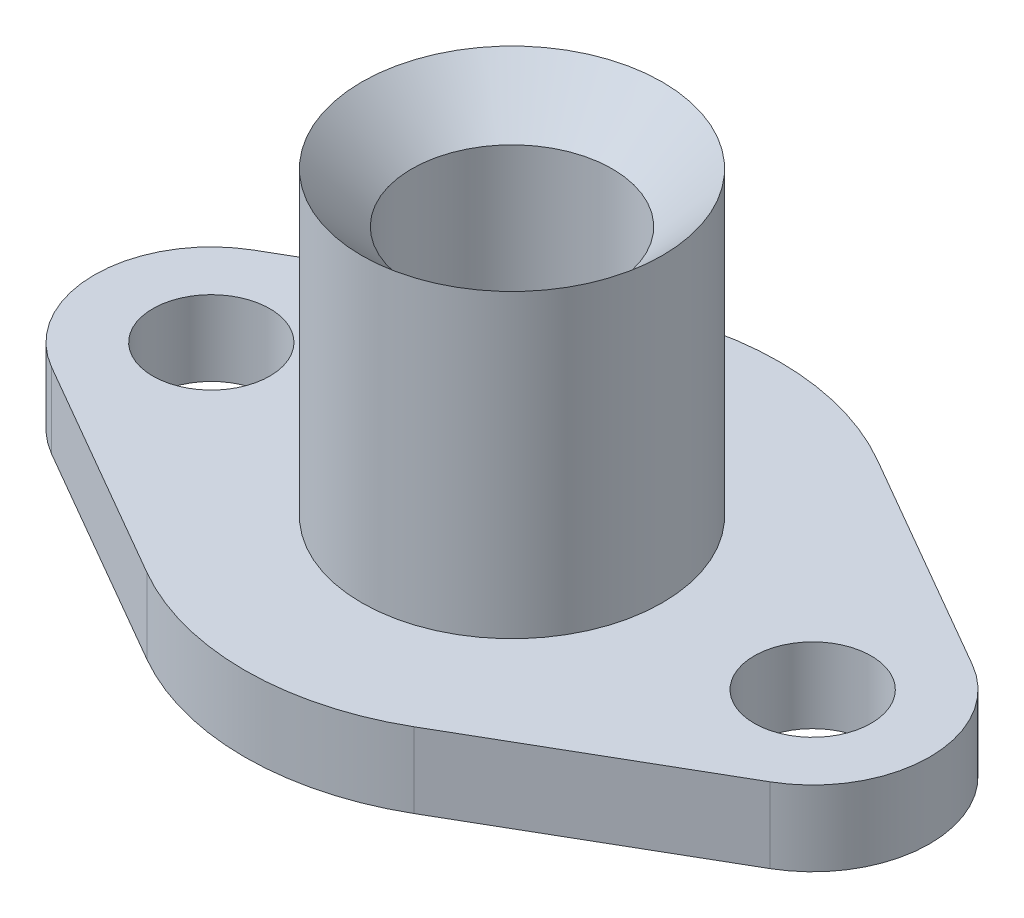
from build123d import *

# Parameters (mm, degrees)
SKETCH_1_R      = 7
SKETCH_1_R_2    = 18
EXTRUDE_1_DEPTH = 9
SKETCH_1_3_R    = 18
SKETCH_1_3_R_2  = 12
EXTRUDE_2_DEPTH = 45
CHAMFER_1_SIZE  = 6


with BuildPart() as part:
    # 草圖1 → 填料-伸長1 (new body)
    with BuildSketch(Plane(origin=(0, 0, 0), x_dir=(1, 0, 0), z_dir=(0, 1, 0))):
        with BuildLine():
            Line((16, -27.712812921), (43, -12.124355653))
            ThreePointArc((43, -12.124355653), (50, 0), (43, 12.124355653))
            Line((43, 12.124355653), (16, 27.712812921))
            ThreePointArc((16, 27.712812921), (0, 32), (-16, 27.712812921))
            Line((-16, 27.712812921), (-43, 12.124355653))
            ThreePointArc((-43, 12.124355653), (-50, 0), (-43, -12.124355653))
            Line((-43, -12.124355653), (-16, -27.712812921))
            ThreePointArc((-16, -27.712812921), (0, -32), (16, -27.712812921))
        make_face()
        with Locations(Location((36, 0, 0), (0, 0, 270))):
            Circle(SKETCH_1_R, mode=Mode.SUBTRACT)
        with Locations(Location((-36, 0, 0), (0, 0, 270))):
            Circle(SKETCH_1_R, mode=Mode.SUBTRACT)
        with Locations(Location((0, 0, 0), (0, 0, 270))):
            Circle(SKETCH_1_R_2, mode=Mode.SUBTRACT)
    extrude(amount=EXTRUDE_1_DEPTH)

    # 草圖1<3> → 填料-伸長2 (add)
    with BuildSketch(Plane(origin=(0, 0, 0), x_dir=(1, 0, 0), z_dir=(0, 1, 0))):
        with Locations(Location((0, 0, 0), (0, 0, 90))):
            Circle(SKETCH_1_3_R)
        with Locations(Location((0, 0, 0), (0, 0, 90))):
            Circle(SKETCH_1_3_R_2, mode=Mode.SUBTRACT)
    extrude(amount=EXTRUDE_2_DEPTH)

    # 導角1
    chamfer_1_edges = [part.edges().sort_by_distance(p)[0] for p in [
        (0, 45, 12),
        (0, 0, 12),
    ]]
    chamfer(chamfer_1_edges, length=CHAMFER_1_SIZE - 0.0001)  # a hair under: the kernel refuses the full size


solid = part.part
